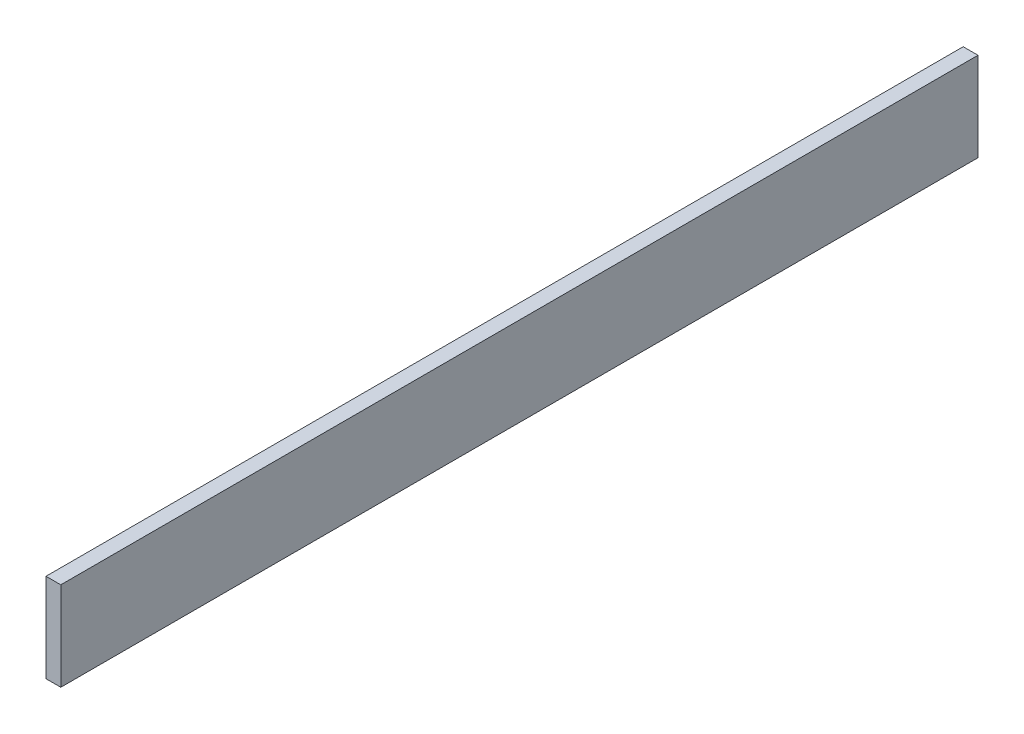
from build123d import *

# Parameters (mm, degrees)
SKETCH1_W           = 393.7
SKETCH1_H           = 38.1
BOSS_EXTRUDE1_DEPTH = 6.35


with BuildPart() as part:
    # Sketch1 → Boss-Extrude1 (new body)
    with BuildSketch(Plane(origin=(0, 0, 0), x_dir=(0, 0, -1), z_dir=(1, 0, 0))):
        with Locations((0, 19.05)):
            Rectangle(SKETCH1_W, SKETCH1_H)
    extrude(amount=BOSS_EXTRUDE1_DEPTH)


solid = part.part
